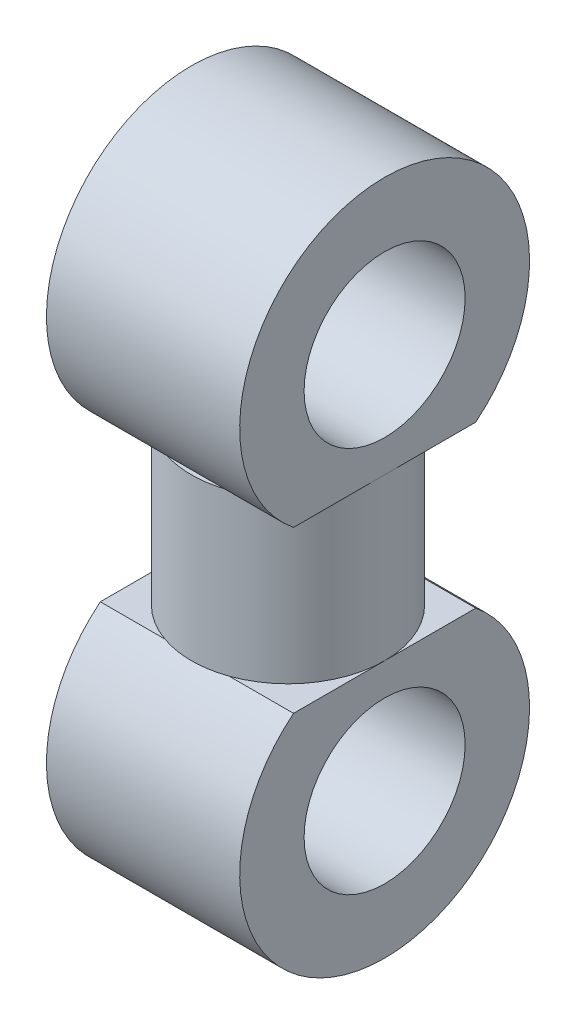
from build123d import *

# Parameters (mm, degrees)
SKETCH1_R            = 3
CRANK_BODY_DEPTH     = 4.5
PIN_SHAFT_BODY_DEPTH = 3
SKETCH4_R            = 2.5
PIN_SHAFT_DEPTH      = 16.00833102
SKETCH1_2_OUTSIDE_W  = 11.382
SKETCH1_2_OUTSIDE_H  = 14.382
SKETCH1_2_OUTSIDE_R  = 3
SMOOTHING_CUTS_DEPTH = 5


with BuildPart() as part:
    # Sketch1 → crank_body (new body)
    with BuildSketch(Plane(origin=(0, 0, 0), x_dir=(1, 0, 0), z_dir=(0, 1, 0))):
        Circle(SKETCH1_R)
    extrude(amount=CRANK_BODY_DEPTH)

    # Sketch3 → pin_shaft_body (add, symmetric)
    with BuildSketch(Plane(origin=(0, 0, 0), x_dir=(0, 0, -1), z_dir=(1, 0, 0))):
        with BuildLine():
            Line((-3, 5), (-3, 4.5))
            Line((-3, 4.5), (3, 4.5))
            Line((3, 4.5), (3, 5))
            Line((3, 5), (2.828427125, 5))
            ThreePointArc((2.828427125, 5), (0, 13), (-2.828427125, 5))
            Line((-2.828427125, 5), (-3, 5))
        make_face()
    pin_shaft_body = extrude(amount=PIN_SHAFT_BODY_DEPTH, both=True)

    # Sketch4 → pin_shaft (cut, through all)
    with BuildSketch(Plane(origin=(3, 0, 0), x_dir=(0, 0, -1), z_dir=(1, 0, 0))):
        with Locations((0, 8.5)):
            Circle(SKETCH4_R)
    pin_shaft = extrude(amount=-PIN_SHAFT_DEPTH, mode=Mode.SUBTRACT)

    # Sketch1<2> outside → smoothing_cuts (cut)
    with BuildSketch(Plane(origin=(0, 0, 0), x_dir=(1, 0, 0), z_dir=(0, 1, 0))):
        Rectangle(SKETCH1_2_OUTSIDE_W, SKETCH1_2_OUTSIDE_H)
        Circle(SKETCH1_2_OUTSIDE_R, mode=Mode.SUBTRACT)
    smoothing_cuts = extrude(amount=SMOOTHING_CUTS_DEPTH, mode=Mode.SUBTRACT)

    # Mirror1: pin_shaft_body, pin_shaft, smoothing_cuts across plane
    add(pin_shaft_body.mirror(Plane(origin=(0, 2.5, 0), x_dir=(0, 0, 1), z_dir=(0, -1, 0))))
    add(pin_shaft.mirror(Plane(origin=(0, 2.5, 0), x_dir=(0, 0, 1), z_dir=(0, -1, 0))), mode=Mode.SUBTRACT)
    add(smoothing_cuts.mirror(Plane(origin=(0, 2.5, 0), x_dir=(0, 0, 1), z_dir=(0, -1, 0))), mode=Mode.SUBTRACT)


solid = part.part
